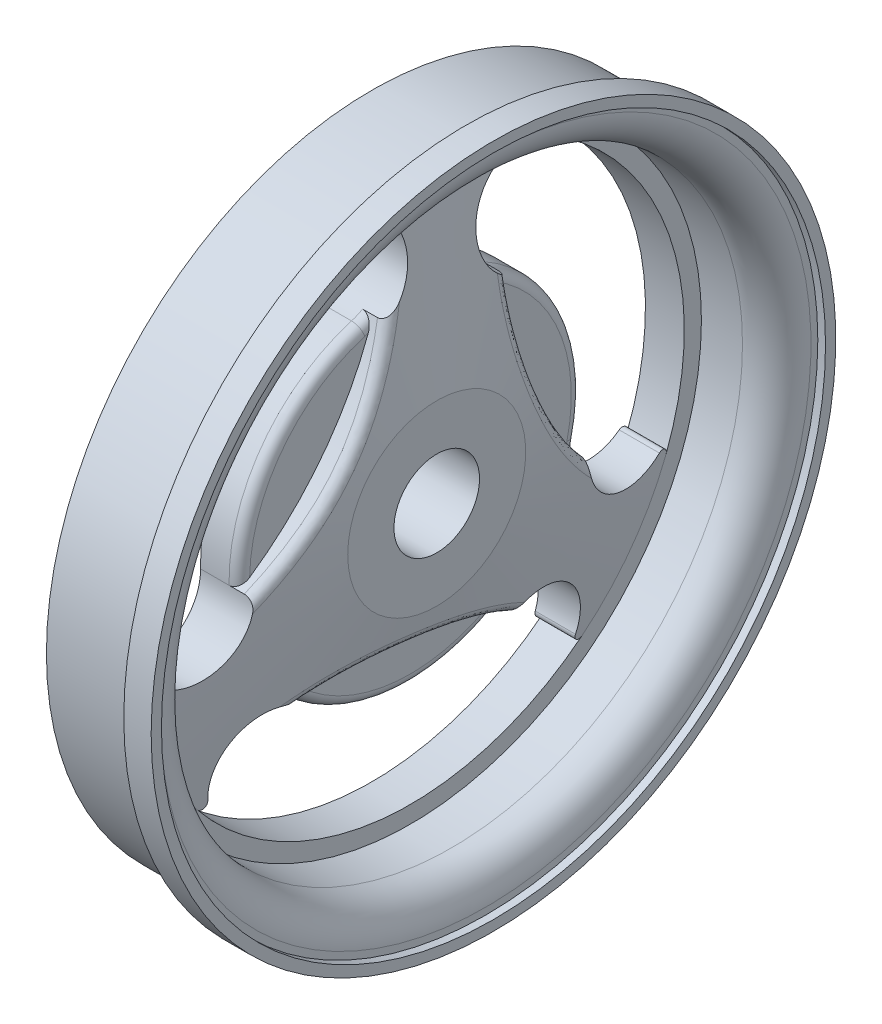
from build123d import *

# Parameters (mm, degrees)
CUT_EXTRUDE1_DEPTH = 15.269509377
SKETCH4_R          = 1.25
CUT_EXTRUDE3_DEPTH = 1.902340099
CUT_EXTRUDE5_START = 10.5
CUT_EXTRUDE5_DEPTH = 10.5
FILLET1_R          = 0.3
FILLET2_R          = 0.3


with BuildPart() as part:
    # Sketch1 → Revolve1 (revolve)
    with BuildSketch(Plane(origin=(0, 0, 0), x_dir=(1, 0, 0), z_dir=(0, 1, 0)), mode=Mode.PRIVATE) as revolve1_sk:
        with BuildLine():
            Line((2.76, 10), (2.76, 9.5))
            Line((2.76, 9.5), (0, 9.5))
            Line((0, 9.5), (0, 0))
            Line((0, 0), (1.902340099, 0))
            Line((1.902340099, 0), (1.902340099, 2.6))
            Line((1.902340099, 2.6), (1.134605944, 8))
            Line((1.134605944, 8), (1.134605944, 8.5))
            Line((1.134605944, 8.5), (1.634605944, 8.5))
            Line((1.634605944, 8.5), (2.334605944, 8.5))
            ThreePointArc((2.334605944, 8.5), (3.041712725, 8.792893219), (3.334605944, 9.5))
            Line((3.334605944, 9.5), (3.334605944, 9.7))
            Line((3.334605944, 9.7), (3.56, 9.7))
            Line((3.56, 9.7), (3.56, 10))
            Line((3.56, 10), (3.26, 10))
            Line((3.26, 10), (2.76, 10))
        make_face()
    revolve(revolve1_sk.sketch.rotate(Axis((-3.466287198, 0, 0), (1, 0, 0)), 180), axis=Axis((-3.466287198, 0, 0), (1, 0, 0)))

    # Sketch2 → Cut-Extrude1 (cut, through all)
    with BuildSketch(Plane(origin=(1.902340099, 0, 0), x_dir=(0, 0, -1), z_dir=(1, 0, 0))):
        with BuildLine():
            ThreePointArc((4.862176183, -1.165865671), (4.572371042, 2.023220959), (2.40711454, 4.382442195))
            ThreePointArc((2.40711454, 4.382442195), (1.648697305, 5.937938154), (2.860903709, 7.172976621))
            ThreePointArc((2.860903709, 7.172976621), (2.983396342, 7.306365189), (2.888223378, 7.460440048))
            ThreePointArc((2.888223378, 7.460440048), (7.315793668, 3.237153535), (7.463678656, -2.879843904))
            ThreePointArc((7.463678656, -2.879843904), (7.413658266, -2.705789557), (7.232561441, -2.706735789))
            ThreePointArc((7.232561441, -2.706735789), (5.503301867, -2.773261777), (4.862176183, -1.165865671))
        make_face()
        with BuildLine():
            ThreePointArc((-6.225857308, -5.02381337), (-0.854439637, -7.954239933), (5.016818916, -6.231494842))
            ThreePointArc((5.016818916, -6.231494842), (4.835799692, -6.236879616), (4.78152812, -6.0641036))
            ThreePointArc((4.78152812, -6.0641036), (4.318056635, -4.396782826), (2.591749001, -4.275843439))
            ThreePointArc((2.591749001, -4.275843439), (-0.534024773, -4.971399958), (-3.44075738, -3.627835257))
            ThreePointArc((-3.44075738, -3.627835257), (-5.153366083, -3.379368333), (-5.960382676, -4.910214048))
            ThreePointArc((-5.960382676, -4.910214048), (-6.050111627, -5.067521615), (-6.225857308, -5.02381337))
        make_face()
        with BuildLine():
            ThreePointArc((-1.237821348, 7.903657274), (-6.461354031, 4.717086398), (-7.905042295, -1.228945207))
            ThreePointArc((-7.905042295, -1.228945207), (-7.819196034, -1.069485573), (-7.642431829, -1.10887302))
            ThreePointArc((-7.642431829, -1.10887302), (-5.96675394, -1.541155328), (-4.998863541, -0.106598756))
            ThreePointArc((-4.998863541, -0.106598756), (-4.03834627, 2.948178999), (-1.421418803, 4.793700928))
            ThreePointArc((-1.421418803, 4.793700928), (-0.349935784, 6.15263011), (-1.272178766, 7.616949837))
            ThreePointArc((-1.272178766, 7.616949837), (-1.363546639, 7.773311172), (-1.237821348, 7.903657274))
        make_face()
    extrude(amount=-CUT_EXTRUDE1_DEPTH, mode=Mode.SUBTRACT)

    # Sketch4 → Cut-Extrude3 (cut)
    with BuildSketch(Plane(origin=(1.902340099, 0, 0), x_dir=(0, 0, -1), z_dir=(1, 0, 0))):
        Circle(SKETCH4_R)
    extrude(amount=-CUT_EXTRUDE3_DEPTH, mode=Mode.SUBTRACT)

    # Sketch6 → Cut-Extrude5 (cut)
    with BuildSketch(Plane(origin=(1.134605944, 0, 0), x_dir=(0, 0, -1), z_dir=(1, 0, 0)).offset(CUT_EXTRUDE5_START)):
        with BuildLine():
            ThreePointArc((2.40711454, 4.382442195), (3.093122213, 1.220256873), (4.820829038, -1.515625373))
            ThreePointArc((4.820829038, -1.515625373), (4.831201688, -1.339527789), (4.862176183, -1.165865671))
            ThreePointArc((4.862176183, -1.165865671), (4.572371042, 2.023220959), (2.40711454, 4.382442195))
        make_face()
        with BuildLine():
            ThreePointArc((-3.44075738, -3.627835257), (-0.534024773, -4.971399958), (2.591749001, -4.275843439))
            ThreePointArc((2.591749001, -4.275843439), (-0.489787655, -3.288850849), (-3.722984594, -3.417147728))
            ThreePointArc((-3.722984594, -3.417147728), (-3.575665939, -3.514179498), (-3.44075738, -3.627835257))
        make_face()
        with BuildLine():
            ThreePointArc((-1.421418803, 4.793700928), (-4.03834627, 2.948178999), (-4.998863541, -0.106598756))
            ThreePointArc((-4.998863541, -0.106598756), (-2.603334557, 2.068593977), (-1.097844444, 4.932773101))
            ThreePointArc((-1.097844444, 4.932773101), (-1.255535749, 4.853707288), (-1.421418803, 4.793700928))
        make_face()
    extrude(amount=-CUT_EXTRUDE5_DEPTH, mode=Mode.SUBTRACT)

    # Fillet1
    # the kernel refuses this fillet: 0.3 mm, written as the material it takes off along each edge
    with BuildSketch(Plane(origin=(1.134605944, 6.231811206, 1.847844444), x_dir=(0, -0.520292174083904, -0.8539883216924247), z_dir=(0, 0.8539883216924247, -0.520292174083904))) as fillet1_piece_1_section:
        with BuildLine():
            CenterArc((1.5 + FILLET1_R, FILLET1_R), FILLET1_R, 180, 90)
            Line((1.5 + FILLET1_R, 0), (1.5, 0))
            Line((1.5, 0), (1.5, FILLET1_R))
        make_face()
    fillet1_piece_1 = revolve(axis=Axis((1.134605944, 6.231811206, 1.847844444), (-1, 0, 0)), revolution_arc=42.132107724, mode=Mode.PRIVATE)
    fillet1_piece_1 = fillet1_piece_1 & Plane(origin=(1.059762453, 7.762702175, 9.95903518), x_dir=(0, -0.8459697029165218, -0.5332309647304175), z_dir=(1, 0, 0)) * Cylinder(9.302107279, 8, mode=Mode.PRIVATE)
    add(fillet1_piece_1, mode=Mode.SUBTRACT)
    with BuildSketch(Plane(origin=(1.134605944, 0, 0), x_dir=(0, 0.9587401855895891, 0.2842837605907876), z_dir=(0, 0.2842837605907876, -0.9587401855895891))) as fillet1_piece_2_section:
        with BuildLine():
            CenterArc((5 - FILLET1_R, -FILLET1_R), FILLET1_R, 0, 90)
            Line((5 - FILLET1_R, 0), (5, 0))
            Line((5, 0), (5, -FILLET1_R))
        make_face()
    fillet1_piece_2 = revolve(axis=Axis((1.134605944, 0, 0), (1, 0, 0)), revolution_arc=83.30232949, mode=Mode.PRIVATE)
    fillet1_piece_2 = fillet1_piece_2 & Plane(origin=(1.050466671, 7.762702175, 9.95903518), x_dir=(0, -0.8459697029165218, -0.5332309647304175), z_dir=(1, 0, 0)) * Cylinder(9.302107279, 20, mode=Mode.PRIVATE)
    add(fillet1_piece_2, mode=Mode.SUBTRACT)
    with BuildSketch(Plane(origin=(1.134605944, -4.716185834, 4.472984594), x_dir=(0, 0.9997216681628299, -0.023592079300660117), z_dir=(0, 0.023592079300660117, 0.9997216681628299))) as fillet1_piece_3_section:
        with BuildLine():
            CenterArc((1.5 + FILLET1_R, FILLET1_R), FILLET1_R, 180, 90)
            Line((1.5 + FILLET1_R, 0), (1.5, 0))
            Line((1.5, 0), (1.5, FILLET1_R))
        make_face()
    fillet1_piece_3 = revolve(axis=Axis((1.134605944, -4.716185834, 4.472984594), (-1, 0, 0)), revolution_arc=42.132107724, mode=Mode.PRIVATE)
    fillet1_piece_3 = fillet1_piece_3 & Plane(origin=(1.059762453, -12.50612855, 1.743179696), x_dir=(0, 0.884776412999289, -0.46601577119246895), z_dir=(1, 0, 0)) * Cylinder(9.302107279, 8, mode=Mode.PRIVATE)
    add(fillet1_piece_3, mode=Mode.SUBTRACT)
    with BuildSketch(Plane(origin=(1.134605944, 0, 0), x_dir=(0, -0.7255670513497934, 0.6881514760541942), z_dir=(0, 0.6881514760541942, 0.7255670513497934))) as fillet1_piece_4_section:
        with BuildLine():
            CenterArc((5 - FILLET1_R, -FILLET1_R), FILLET1_R, 0, 90)
            Line((5 - FILLET1_R, 0), (5, 0))
            Line((5, 0), (5, -FILLET1_R))
        make_face()
    fillet1_piece_4 = revolve(axis=Axis((1.134605944, 0, 0), (1, 0, 0)), revolution_arc=83.30232949, mode=Mode.PRIVATE)
    fillet1_piece_4 = fillet1_piece_4 & Plane(origin=(1.050466671, -12.50612855, 1.743179696), x_dir=(0, 0.884776412999289, -0.46601577119246895), z_dir=(1, 0, 0)) * Cylinder(9.302107279, 21, mode=Mode.PRIVATE)
    add(fillet1_piece_4, mode=Mode.SUBTRACT)
    with BuildSketch(Plane(origin=(1.134605944, 0, 0), x_dir=(0, -0.2331731342397902, -0.9724352366449874), z_dir=(0, -0.9724352366449874, 0.2331731342397902))) as fillet1_piece_5_section:
        with BuildLine():
            CenterArc((5 - FILLET1_R, -FILLET1_R), FILLET1_R, 0, 90)
            Line((5 - FILLET1_R, 0), (5, 0))
            Line((5, 0), (5, -FILLET1_R))
        make_face()
    fillet1_piece_5 = revolve(axis=Axis((1.134605944, 0, 0), (1, 0, 0)), revolution_arc=83.30232949, mode=Mode.PRIVATE)
    fillet1_piece_5 = fillet1_piece_5 & Plane(origin=(1.050466671, 4.743426375, -11.702214876), x_dir=(0, -0.03880671008277669, 0.9992467359228907), z_dir=(1, 0, 0)) * Cylinder(9.302107279, 20, mode=Mode.PRIVATE)
    add(fillet1_piece_5, mode=Mode.SUBTRACT)
    with BuildSketch(Plane(origin=(1.134605944, -1.515625373, -6.320829038), x_dir=(0, -0.47942949407895097, 0.8775804009930949), z_dir=(0, -0.8775804009930949, -0.47942949407895097))) as fillet1_piece_6_section:
        with BuildLine():
            CenterArc((1.5 + FILLET1_R, FILLET1_R), FILLET1_R, 180, 90)
            Line((1.5 + FILLET1_R, 0), (1.5, 0))
            Line((1.5, 0), (1.5, FILLET1_R))
        make_face()
    fillet1_piece_6 = revolve(axis=Axis((1.134605944, -1.515625373, -6.320829038), (-1, 0, 0)), revolution_arc=42.132107724, mode=Mode.PRIVATE)
    fillet1_piece_6 = fillet1_piece_6 & Plane(origin=(1.059762453, 4.743426375, -11.702214876), x_dir=(0, -0.03880671008277669, 0.9992467359228907), z_dir=(1, 0, 0)) * Cylinder(9.302107279, 8, mode=Mode.PRIVATE)
    add(fillet1_piece_6, mode=Mode.SUBTRACT)

    # Fillet2
    fillet2_edges = [part.edges().sort_by_distance(p)[0] for p in [
        (1.799247012, 1.220042529, -3.093209934),
        (1.798782815, 2.147401949, 2.54299829),
        (1.799247012, -3.288819646, 0.490017144),
    ]]
    fillet(fillet2_edges, radius=FILLET2_R)


solid = part.part
